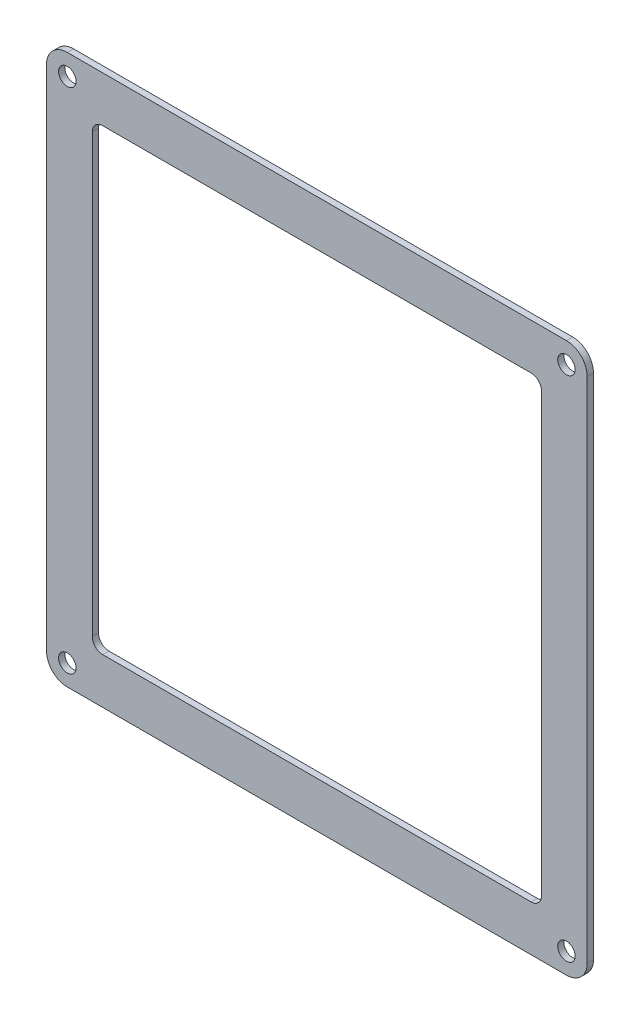
from build123d import *

# Parameters (mm, degrees)
SKETCH_1_W              = 260
SKETCH_1_H              = 264.25
SKETCH_1_W_2            = 216
SKETCH_1_H_2            = 220.25
EXTRUDE_1_DEPTH         = 3
FILLET_1_R              = 10
FILLET_2_R              = 5
HOLE_WIZARD_8_4_8_4_1_D = 8.4


with BuildPart() as part:
    # 草图1 → 凸台-拉伸1 (new body)
    with BuildSketch(Plane.XY):
        Rectangle(SKETCH_1_W, SKETCH_1_H)
        Rectangle(SKETCH_1_W_2, SKETCH_1_H_2, mode=Mode.SUBTRACT)
    extrude(amount=EXTRUDE_1_DEPTH)

    # 圆角1
    fillet_1_edges = [part.edges().sort_by_distance(p)[0] for p in [
        (130, 132.125, 1.5),
        (130, -132.125, 1.5),
        (-130, -132.125, 1.5),
        (-130, 132.125, 1.5),
    ]]
    fillet(fillet_1_edges, radius=FILLET_1_R)

    # 圆角2
    fillet_2_edges = [part.edges().sort_by_distance(p)[0] for p in [
        (-108, 110.125, 1.5),
        (-108, -110.125, 1.5),
        (108, -110.125, 1.5),
        (108, 110.125, 1.5),
    ]]
    fillet(fillet_2_edges, radius=FILLET_2_R)

    # Ø8.4 (8.4) 直径孔1 (through all)
    with Locations(Plane.XY.offset(3)):
        with Locations((120, -122.125), (-120, 122.125), (-120, -122.125), (120, 122.125)):
            Hole(HOLE_WIZARD_8_4_8_4_1_D / 2)


solid = part.part
